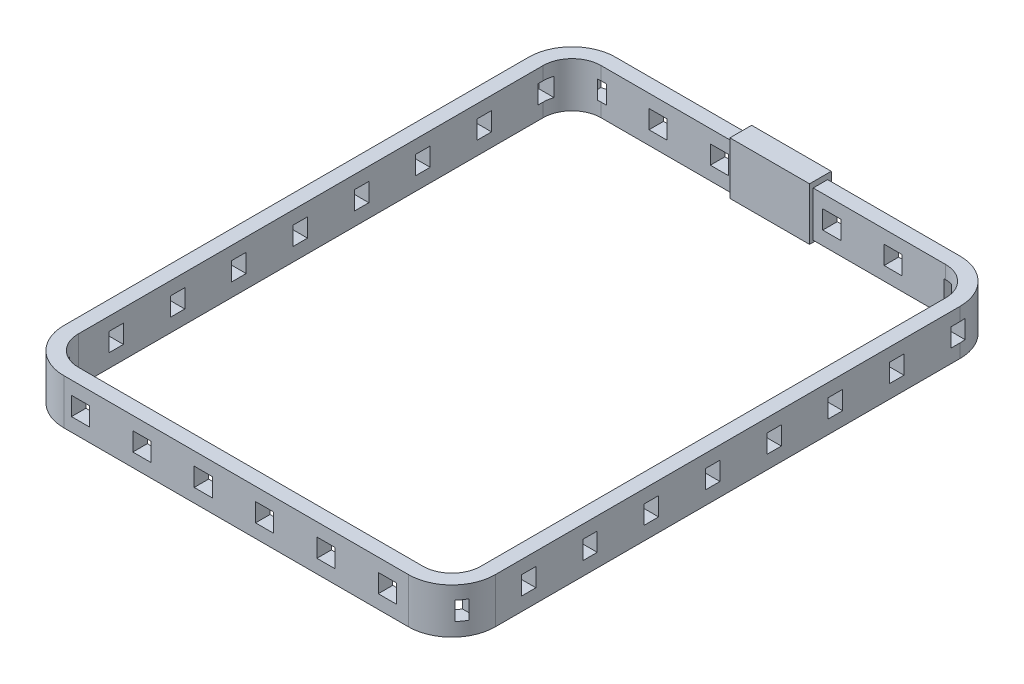
from build123d import *

# Parameters (mm, degrees)
BOSS_EXTRUDE1_DEPTH      = 12.5
BOSS_EXTRUDE2_DEPTH      = 14
BOSS_EXTRUDE2_DEPTH_BACK = 0.5
SKETCH3_W                = 22
SKETCH3_H                = 6
SKETCH2_W                = 5
SKETCH2_H                = 5
CUT_EXTRUDE2_DEPTH       = 99.529183494
SKETCH5_W                = 5
SKETCH5_H                = 4
CUT_EXTRUDE7_DEPTH       = 5.1
CRVPATTERN2_START        = 3.75
CRVPATTERN2_OUTLINE_W    = 4
CRVPATTERN2_OUTLINE_H    = 4
CRVPATTERN2_OUTLINE_W_2  = 5
CRVPATTERN2_DEPTH        = 5.1


# Read off the part's stored shape, not the designer's step: CrvPattern2
with BuildPart() as part:
    # Sketch1 → Boss-Extrude1 (new body)
    with BuildSketch(Plane(origin=(0, 0, 0), x_dir=(1, 0, 0), z_dir=(0, 1, 0))):
        with BuildLine():
            Line((-59.6, -64.2), (-59.6, 64.2))
            ThreePointArc((-59.6, 64.2), (-56.085281374, 72.685281374), (-47.6, 76.2))
            Line((-47.6, 76.2), (47.6, 76.2))
            ThreePointArc((47.6, 76.2), (56.085281374, 72.685281374), (59.6, 64.2))
            Line((59.6, 64.2), (59.6, -64.2))
            ThreePointArc((59.6, -64.2), (56.085281374, -72.685281374), (47.6, -76.2))
            Line((47.6, -76.2), (-47.6, -76.2))
            ThreePointArc((-47.6, -76.2), (-56.085281374, -72.685281374), (-59.6, -64.2))
        make_face()
        with BuildLine():
            Line((-55.6, -64.2), (-55.6, 64.2))
            ThreePointArc((-55.6, 64.2), (-53.256854249, 69.856854249), (-47.6, 72.2))
            Line((-47.6, 72.2), (47.6, 72.2))
            ThreePointArc((47.6, 72.2), (53.256854249, 69.856854249), (55.6, 64.2))
            Line((55.6, 64.2), (55.6, -64.2))
            ThreePointArc((55.6, -64.2), (53.256854249, -69.856854249), (47.6, -72.2))
            Line((47.6, -72.2), (-47.6, -72.2))
            ThreePointArc((-47.6, -72.2), (-53.256854249, -69.856854249), (-55.6, -64.2))
        make_face(mode=Mode.SUBTRACT)
    extrude(amount=BOSS_EXTRUDE1_DEPTH)

    # Sketch3 → Boss-Extrude2 (add, two sides: drawn at the far end of the back side and taken through both)
    with BuildSketch(Plane(origin=(0, 0, 0), x_dir=(1, 0, 0), z_dir=(0, 1, 0)).offset(-BOSS_EXTRUDE2_DEPTH_BACK)):
        with Locations((0, 74.2)):
            Rectangle(SKETCH3_W, SKETCH3_H)
    extrude(amount=BOSS_EXTRUDE2_DEPTH + BOSS_EXTRUDE2_DEPTH_BACK)

    # Sketch2 → Cut-Extrude2 (cut, through all)
    with BuildSketch(Plane.XY):
        with Locations((-14.9, 6.25)):
            Rectangle(SKETCH2_W, SKETCH2_H)
    extrude(amount=-CUT_EXTRUDE2_DEPTH, mode=Mode.SUBTRACT)

    # Sketch5 → Cut-Extrude7 (cut)
    with BuildSketch(Plane(origin=(0, 3.75, 0), x_dir=(1, 0, 0), z_dir=(0, 1, 0))):
        with Locations((-14.9, 74.2)):
            Rectangle(SKETCH5_W, SKETCH5_H)
    extrude(amount=CUT_EXTRUDE7_DEPTH, mode=Mode.SUBTRACT)

    # CrvPattern2 outline → CrvPattern2 (cut)
    with BuildSketch(Plane(origin=(0, 0, 0), x_dir=(1, 0, 0), z_dir=(0, 1, 0)).offset(CRVPATTERN2_START)):
        with Locations((-57.6, -53.750444078)):
            Rectangle(CRVPATTERN2_OUTLINE_W, CRVPATTERN2_OUTLINE_H)
        with Locations((-57.6, -36.800444078)):
            Rectangle(CRVPATTERN2_OUTLINE_W, CRVPATTERN2_OUTLINE_H)
        with BuildLine():
            Line((-58.668315173, -67.355965001), (-58.668315173, -68.835989563))
            ThreePointArc((-58.668315173, -68.835989563), (-58.02699983, -70.139501204), (-57.232868986, -71.355965001))
            Line((-57.232868986, -71.355965001), (-53.668315173, -71.355965001))
            Line((-53.668315173, -71.355965001), (-53.668315173, -69.413017452))
            ThreePointArc((-53.668315173, -69.413017452), (-54.388121683, -68.433367926), (-54.951182551, -67.355965001))
            Line((-54.951182551, -67.355965001), (-58.668315173, -67.355965001))
        make_face()
        with Locations((-57.6, -19.850444078)):
            Rectangle(CRVPATTERN2_OUTLINE_W, CRVPATTERN2_OUTLINE_H)
        with Locations((-57.6, -2.900444078)):
            Rectangle(CRVPATTERN2_OUTLINE_W, CRVPATTERN2_OUTLINE_H)
        with Locations((-42.999111843, -74.2)):
            Rectangle(CRVPATTERN2_OUTLINE_W_2, CRVPATTERN2_OUTLINE_H)
        with Locations((-57.6, 14.049555922)):
            Rectangle(CRVPATTERN2_OUTLINE_W, CRVPATTERN2_OUTLINE_H)
        with Locations((-26.049111843, -74.2)):
            Rectangle(CRVPATTERN2_OUTLINE_W_2, CRVPATTERN2_OUTLINE_H)
        with Locations((-57.6, 30.999555922)):
            Rectangle(CRVPATTERN2_OUTLINE_W, CRVPATTERN2_OUTLINE_H)
        with Locations((-9.099111843, -74.2)):
            Rectangle(CRVPATTERN2_OUTLINE_W_2, CRVPATTERN2_OUTLINE_H)
        with Locations((-57.6, 47.949555922)):
            Rectangle(CRVPATTERN2_OUTLINE_W, CRVPATTERN2_OUTLINE_H)
        with Locations((7.850888157, -74.2)):
            Rectangle(CRVPATTERN2_OUTLINE_W_2, CRVPATTERN2_OUTLINE_H)
        with BuildLine():
            Line((-59.6, 64.2), (-59.6, 62.782633128))
            Line((-59.6, 62.782633128), (-55.6, 62.782633128))
            Line((-55.6, 62.782633128), (-55.6, 64.2))
            ThreePointArc((-55.6, 64.2), (-55.492188057, 65.50895671), (-55.171658083, 66.782633128))
            Line((-55.171658083, 66.782633128), (-59.318788595, 66.782633128))
            ThreePointArc((-59.318788595, 66.782633128), (-59.529489996, 65.498948972), (-59.6, 64.2))
        make_face()
        with Locations((24.800888157, -74.2)):
            Rectangle(CRVPATTERN2_OUTLINE_W_2, CRVPATTERN2_OUTLINE_H)
        with Locations((41.750888157, -74.2)):
            Rectangle(CRVPATTERN2_OUTLINE_W_2, CRVPATTERN2_OUTLINE_H)
        with BuildLine():
            ThreePointArc((-48.69384848, 76.150041653), (-49.908151807, 75.975926088), (-51.098334166, 75.678748105))
            Line((-51.098334166, 75.678748105), (-51.098334166, 72.150041653))
            Line((-51.098334166, 72.150041653), (-48.492657672, 72.150041653))
            ThreePointArc((-48.492657672, 72.150041653), (-48.04702728, 72.187500648), (-47.6, 72.2))
            Line((-47.6, 72.2), (-46.098334166, 72.2))
            Line((-46.098334166, 72.2), (-46.098334166, 76.150041653))
            Line((-46.098334166, 76.150041653), (-48.69384848, 76.150041653))
        make_face()
        with BuildLine():
            Line((53.086653046, -72.217754824), (56.528359736, -72.217754823))
            ThreePointArc((56.528359736, -72.217754823), (57.368745391, -71.16933379), (58.086653046, -70.033533053))
            Line((58.086653046, -70.033533053), (58.086653046, -68.217754824))
            Line((58.086653046, -68.217754824), (54.517922099, -68.217754823))
            ThreePointArc((54.517922099, -68.217754823), (53.867556959, -69.171692846), (53.086653046, -70.02208196))
            Line((53.086653046, -70.02208196), (53.086653046, -72.217754824))
        make_face()
        with Locations((-31.85, 74.2)):
            Rectangle(CRVPATTERN2_OUTLINE_W_2, CRVPATTERN2_OUTLINE_H)
        with Locations((57.6, -54.998667765)):
            Rectangle(CRVPATTERN2_OUTLINE_W, CRVPATTERN2_OUTLINE_H)
        with Locations((57.6, -38.048667765)):
            Rectangle(CRVPATTERN2_OUTLINE_W, CRVPATTERN2_OUTLINE_H)
        with Locations((57.6, -21.098667765)):
            Rectangle(CRVPATTERN2_OUTLINE_W, CRVPATTERN2_OUTLINE_H)
        with Locations((57.6, -4.148667765)):
            Rectangle(CRVPATTERN2_OUTLINE_W, CRVPATTERN2_OUTLINE_H)
        with Locations((57.6, 12.801332235)):
            Rectangle(CRVPATTERN2_OUTLINE_W, CRVPATTERN2_OUTLINE_H)
        with Locations((57.6, 29.751332235)):
            Rectangle(CRVPATTERN2_OUTLINE_W, CRVPATTERN2_OUTLINE_H)
        with Locations((57.6, 46.701332235)):
            Rectangle(CRVPATTERN2_OUTLINE_W, CRVPATTERN2_OUTLINE_H)
        with BuildLine():
            Line((55.6, 61.651332235), (59.6, 61.651332235))
            Line((59.6, 61.651332235), (59.6, 64.2))
            ThreePointArc((59.6, 64.2), (59.577957622, 64.927001521), (59.511911465, 65.651332235))
            Line((59.511911465, 65.651332235), (55.467250774, 65.651332235))
            ThreePointArc((55.467250774, 65.651332235), (55.566743569, 64.928695343), (55.6, 64.2))
            Line((55.6, 64.2), (55.6, 61.651332235))
        make_face()
        with BuildLine():
            Line((52.126062512, 71.992602856), (52.126062512, 75.313719365))
            ThreePointArc((52.126062512, 75.313719365), (50.990753204, 75.71098574), (49.821377474, 75.992602856))
            Line((49.821377474, 75.992602856), (47.126062512, 75.992602856))
            Line((47.126062512, 75.992602856), (47.126062512, 72.2))
            Line((47.126062512, 72.2), (47.6, 72.2))
            ThreePointArc((47.6, 72.2), (48.510817531, 72.147981594), (49.409790244, 71.992602856))
            Line((49.409790244, 71.992602856), (52.126062512, 71.992602856))
        make_face()
        with Locations((33.098223686, 74.2)):
            Rectangle(CRVPATTERN2_OUTLINE_W_2, CRVPATTERN2_OUTLINE_H)
        with Locations((16.148223686, 74.2)):
            Rectangle(CRVPATTERN2_OUTLINE_W_2, CRVPATTERN2_OUTLINE_H)
    extrude(amount=CRVPATTERN2_DEPTH, mode=Mode.SUBTRACT)


solid = part.part
